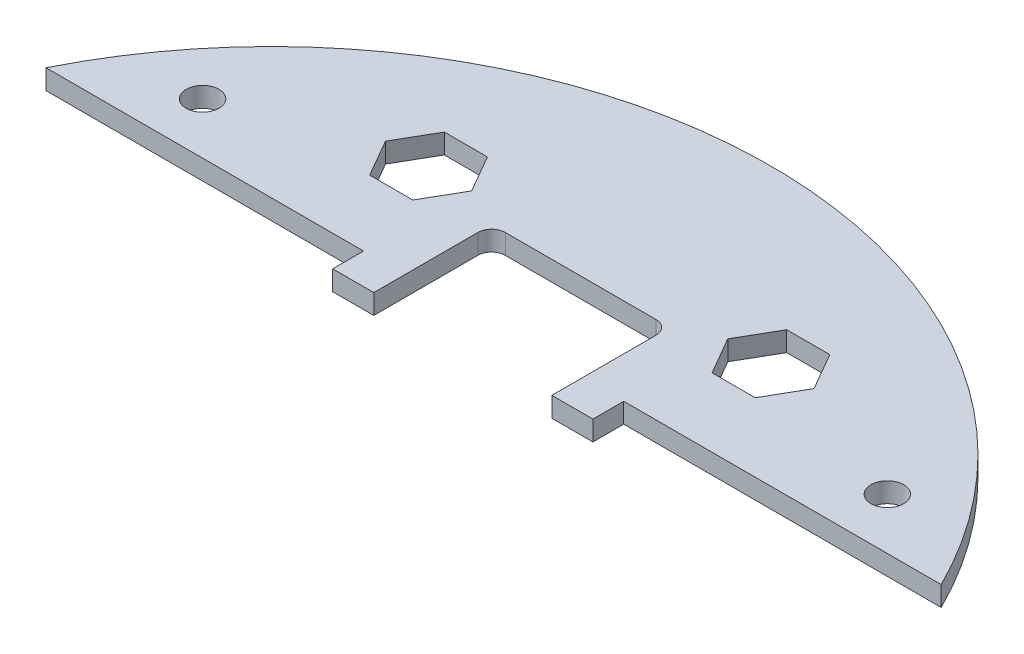
from build123d import *

# Parameters (mm, degrees)
BOSS_EXTRUDE1_DEPTH  = 2.9
SOLENOID_PLACEMENT_W = 38
SOLENOID_PLACEMENT_H = 64
CUT_EXTRUDE1_DEPTH   = 104.278313309
CUT_EXTRUDE4_DEPTH   = 104.278313309
CUT_EXTRUDE5_DEPTH   = 104.278313309
SKETCH6_R            = 2.4
CUT_EXTRUDE6_DEPTH   = 104.278313309
CUT_EXTRUDE3_DEPTH   = 104.278313309
SKETCH7_W            = 10
SKETCH7_H            = 62.80248699
CUT_EXTRUDE7_DEPTH   = 99.031423533


with BuildPart() as part:
    # Sketch1 → Boss-Extrude1 (new body)
    with BuildSketch(Plane(origin=(0, 0, 0), x_dir=(1, 0, 0), z_dir=(0, 1, 0))):
        with BuildLine():
            ThreePointArc((36.856602833, -63.012624351), (0, 73), (-36.856602833, -63.012624351))
            ThreePointArc((-36.856602833, -63.012624351), (-33.368752207, -63.602994345), (-30.363140064, -61.737536127))
            ThreePointArc((-30.363140064, -61.737536127), (0, -46.75), (30.363140064, -61.737536127))
            ThreePointArc((30.363140064, -61.737536127), (33.368752207, -63.602994345), (36.856602833, -63.012624351))
        make_face()
    extrude(amount=BOSS_EXTRUDE1_DEPTH)

    # solenoid placement → Cut-Extrude1 (cut, through all)
    with BuildSketch(Plane(origin=(0, 2.9, 0), x_dir=(1, 0, 0), z_dir=(0, 1, 0))):
        with Locations((0, -4)):
            Rectangle(SOLENOID_PLACEMENT_W, SOLENOID_PLACEMENT_H)
    extrude(amount=-CUT_EXTRUDE1_DEPTH, mode=Mode.SUBTRACT)

    # Sketch4 → Cut-Extrude4 (cut, through all)
    with BuildSketch(Plane(origin=(0, 2.9, 0), x_dir=(1, 0, 0), z_dir=(0, 1, 0))):
        with BuildLine():
            Line((-13, 28), (13, 28))
            Line((13, 28), (13, 43.2))
            ThreePointArc((13, 43.2), (12.414213562, 44.614213562), (11, 45.2))
            Line((11, 45.2), (-11, 45.2))
            ThreePointArc((-11, 45.2), (-12.414213562, 44.614213562), (-13, 43.2))
            Line((-13, 43.2), (-13, 28))
        make_face()
    extrude(amount=-CUT_EXTRUDE4_DEPTH, mode=Mode.SUBTRACT)

    # Sketch5 → Cut-Extrude5 (cut, through all)
    with BuildSketch(Plane(origin=(0, 2.9, 0), x_dir=(1, 0, 0), z_dir=(0, 1, 0))):
        Polygon((-18.706882066, 48), (-21.853441033, 53.45), (-28.146558967, 53.45), (-31.293117934, 48), (-28.146558967, 42.55), (-21.853441033, 42.55), align=None)
        Polygon((21.853441033, 42.55), (18.706882066, 48), (21.853441033, 53.45), (28.146558967, 53.45), (31.293117934, 48), (28.146558967, 42.55), align=None)
    extrude(amount=-CUT_EXTRUDE5_DEPTH, mode=Mode.SUBTRACT)

    # Sketch6 → Cut-Extrude6 (cut, through all)
    with BuildSketch(Plane(origin=(0, 2.9, 0), x_dir=(1, 0, 0), z_dir=(0, 1, 0))):
        with Locations((40, -40)):
            Circle(SKETCH6_R)
        with Locations((-40, -40)):
            Circle(SKETCH6_R)
        with Locations((-50, 40)):
            Circle(SKETCH6_R)
        with Locations((50, 40)):
            Circle(SKETCH6_R)
    extrude(amount=-CUT_EXTRUDE6_DEPTH, mode=Mode.SUBTRACT)

    # Sketch3 → Cut-Extrude3 (cut, through all)
    with BuildSketch(Plane(origin=(0, 2.9, 0), x_dir=(1, 0, 0), z_dir=(0, 1, 0))):
        Polygon((-19, 28), (19, 28), (19, 32.5), (73, 32.5), (73, -32.5), (-73, -32.5), (-73, 32.5), (-19, 32.5), align=None)
    extrude(amount=-CUT_EXTRUDE3_DEPTH, mode=Mode.SUBTRACT)


with BuildPart() as cut_extrude3_piece_1:
    # of the separate pieces the step leaves, piece 1, a body of its own (cut_extrude3_pieces)
    add(part.part.solids().sort_by_distance((65.366275709, 0, -32.5))[0])


with BuildPart() as cut_extrude3_piece_2:
    # of the separate pieces the step leaves, piece 2, a body of its own (cut_extrude3_pieces)
    add(part.part.solids().sort_by_distance((-36.856602833, 0, 63.012624351))[0])

    # Sketch7 → Cut-Extrude7 (cut, through all)
    with BuildSketch(Plane(origin=(0, 2.9, 0), x_dir=(1, 0, 0), z_dir=(0, 1, 0))):
        with Locations((0, -31.401243495)):
            Rectangle(SKETCH7_W, SKETCH7_H)
    extrude(amount=-CUT_EXTRUDE7_DEPTH, mode=Mode.SUBTRACT)


with BuildPart() as cut_extrude7_piece_1:
    # of the separate pieces the step leaves, piece 1, a body of its own (cut_extrude7_pieces)
    add(cut_extrude3_piece_2.part.solids().sort_by_distance((5, 0, 47.078205475))[0])


with BuildPart() as cut_extrude7_piece_2:
    # of the separate pieces the step leaves, piece 2, a body of its own (cut_extrude7_pieces)
    add(cut_extrude3_piece_2.part.solids().sort_by_distance((-36.856602833, 0, 63.012624351))[0])


solid = cut_extrude3_piece_1.part
